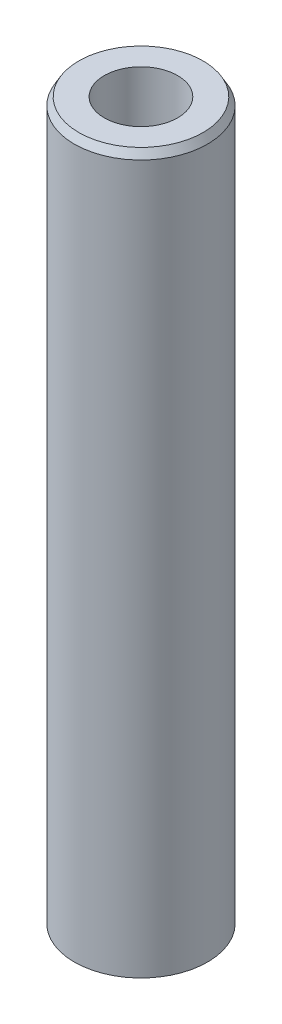
from build123d import *
from OCP.BRepFilletAPI import BRepFilletAPI_MakeChamfer

# Parameters (mm, degrees)
SKETCH1_R           = 22.5
BOSS_EXTRUDE1_DEPTH = 243.446333863
SKETCH2_R           = 12.391321951
CUT_EXTRUDE1_DEPTH  = 246.517041102
CHAMFER1_SIZE       = 2.628786087
CHAMFER1_SIZE2      = 1.517730355


with BuildPart() as part:
    # Sketch1 → Boss-Extrude1 (new body)
    with BuildSketch(Plane(origin=(0, 0, 0), x_dir=(1, 0, 0), z_dir=(0, 1, 0))):
        Circle(SKETCH1_R)
    extrude(amount=BOSS_EXTRUDE1_DEPTH)

    # Sketch2 → Cut-Extrude1 (cut, through all)
    with BuildSketch(Plane(origin=(0, 0, 0), x_dir=(1, 0, 0), z_dir=(0, 1, 0))):
        Circle(SKETCH2_R)
    extrude(amount=CUT_EXTRUDE1_DEPTH, mode=Mode.SUBTRACT)

    # Chamfer1: one chamfer whose edges measure the first distance from different faces: ONE call of the kernel's chamfer builder (chamfer() names one face for all edges)
    chamfer1_edges_1 = [part.edges().sort_by_distance(p)[0] for p in [
        (-22.5, 243.446333863, 0),
    ]]
    chamfer1_side_1 = [part.faces().sort_by_distance(p)[0] for p in [
        (-22.5, 121.723166931, 0),
    ]]
    chamfer1_edges_2 = [part.edges().sort_by_distance(p)[0] for p in [
        (-22.5, 0, 0),
    ]]
    chamfer1_side_2 = [part.faces().sort_by_distance(p)[0] for p in [
        (-21.863603897, 0, 0),
    ]]
    chamfer1 = BRepFilletAPI_MakeChamfer(part.part.solid().wrapped)
    for e in chamfer1_edges_1:
        chamfer1.Add(CHAMFER1_SIZE, CHAMFER1_SIZE2, e.wrapped, chamfer1_side_1[0].wrapped)  # the first distance lies on this face
    for e in chamfer1_edges_2:
        chamfer1.Add(CHAMFER1_SIZE, CHAMFER1_SIZE2, e.wrapped, chamfer1_side_2[0].wrapped)  # the first distance lies on this face
    add(Compound.cast(chamfer1.Shape()), mode=Mode.REPLACE)


solid = part.part
